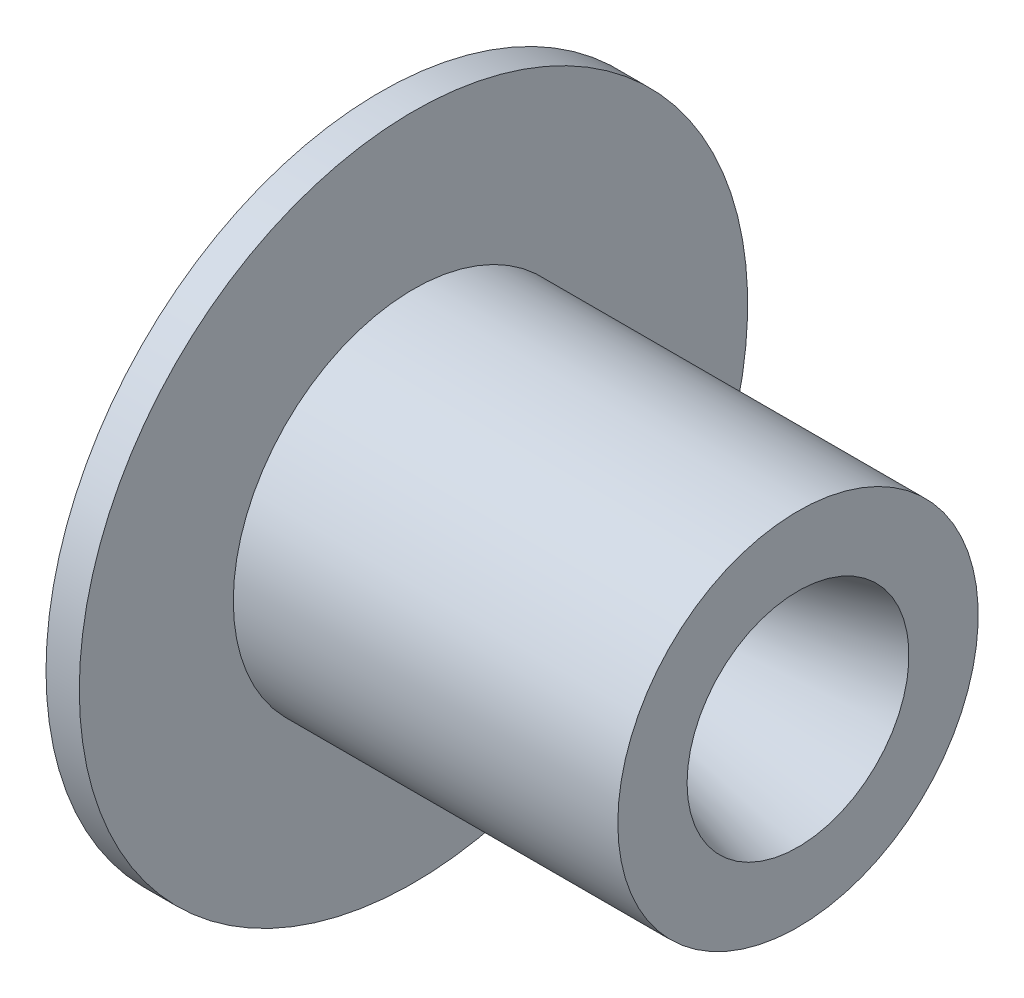
from build123d import *

# Parameters (mm, degrees)
RAO_INLET_RADIUS_R  = 20.8
RAO_OUTLET_RADIUS_R = 5.306744


with BuildPart() as part:
    # Sketch1 → Nozzle (revolve)
    with BuildSketch(Plane.XY):
        Polygon((20, 9.421166631), (26.5, 9.421166631), (63.760795263, 19.405166631), (63.760795263, 29.975166631), (5.08, 29.975166631), (5.08, 53.475166631), (0, 53.475166631), (0, 27.875166631), align=None)
    revolve(axis=Axis((-7.016641837, 2.475166631, 0), (1, 0, 0)))

    # Rao inlet radius
    rao_inlet_radius_edges = [part.edges().sort_by_distance(p)[0] for p in [
        (26.5, -4.470833369, 0),
    ]]
    fillet(rao_inlet_radius_edges, radius=RAO_INLET_RADIUS_R)

    # Rao outlet radius
    rao_outlet_radius_edges = [part.edges().sort_by_distance(p)[0] for p in [
        (20, -4.470833369, 0),
    ]]
    fillet(rao_outlet_radius_edges, radius=RAO_OUTLET_RADIUS_R)


solid = part.part
